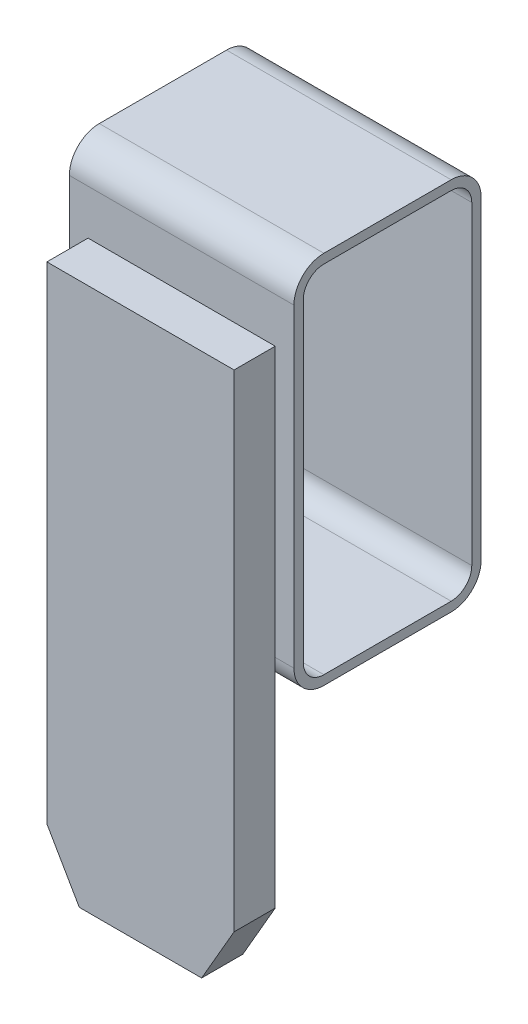
from build123d import *
from OCP.BRepFilletAPI import BRepFilletAPI_MakeChamfer

# Parameters (mm, degrees)
MEMBRO_STRUTTURALE1_DEPTH = 120
SCHIZZO3_W                = 100
SCHIZZO3_H                = 290
ESTRUSIONE1_DEPTH         = 22
SMUSSO1_SIZE              = 30
SMUSSO1_SIZE2             = 17.320508076


# Read off the part's stored shape, not the designer's step: Membro strutturale1
with BuildPart() as part:
    # Membro strutturale1 outline → Membro strutturale1 (new body)
    with BuildSketch(Plane.YZ):
        with BuildLine():
            ThreePointArc((84, -50), (95.313708499, -45.313708499), (100, -34))
            Line((100, -34), (100, 34))
            ThreePointArc((100, 34), (95.313708499, 45.313708499), (84, 50))
            Line((84, 50), (-84, 50))
            ThreePointArc((-84, 50), (-95.313708499, 45.313708499), (-100, 34))
            Line((-100, 34), (-100, -34))
            ThreePointArc((-100, -34), (-95.313708499, -45.313708499), (-84, -50))
            Line((-84, -50), (84, -50))
        make_face()
        with BuildLine():
            Line((-84, 45), (84, 45))
            ThreePointArc((84, 45), (91.778174593, 41.778174593), (95, 34))
            Line((95, 34), (95, -34))
            ThreePointArc((95, -34), (91.778174593, -41.778174593), (84, -45))
            Line((84, -45), (-84, -45))
            ThreePointArc((-84, -45), (-91.778174593, -41.778174593), (-95, -34))
            Line((-95, -34), (-95, 34))
            ThreePointArc((-95, 34), (-91.778174593, 41.778174593), (-84, 45))
        make_face(mode=Mode.SUBTRACT)
    extrude(amount=MEMBRO_STRUTTURALE1_DEPTH)


with BuildPart() as body_2:
    # Schizzo3 → Estrusione1 (new body)
    with BuildSketch(Plane.XY.offset(50)):
        with Locations((60, -85)):
            Rectangle(SCHIZZO3_W, SCHIZZO3_H)
    extrude(amount=ESTRUSIONE1_DEPTH)

    # Smusso1: one chamfer whose edges measure the first distance from different faces: ONE call of the kernel's chamfer builder (chamfer() names one face for all edges)
    smusso1_edges_1 = [body_2.edges().sort_by_distance(p)[0] for p in [
        (110, -230, 61),
    ]]
    smusso1_side_1 = [body_2.faces().sort_by_distance(p)[0] for p in [
        (110, -85, 61),
    ]]
    smusso1_edges_2 = [body_2.edges().sort_by_distance(p)[0] for p in [
        (10, -230, 61),
    ]]
    smusso1_side_2 = [body_2.faces().sort_by_distance(p)[0] for p in [
        (10, -85, 61),
    ]]
    smusso1 = BRepFilletAPI_MakeChamfer(body_2.part.solid().wrapped)
    for e in smusso1_edges_1:
        smusso1.Add(SMUSSO1_SIZE, SMUSSO1_SIZE2, e.wrapped, smusso1_side_1[0].wrapped)  # the first distance lies on this face
    for e in smusso1_edges_2:
        smusso1.Add(SMUSSO1_SIZE, SMUSSO1_SIZE2, e.wrapped, smusso1_side_2[0].wrapped)  # the first distance lies on this face
    add(Compound.cast(smusso1.Shape()), mode=Mode.REPLACE)


solid = Compound([part.part, body_2.part])
